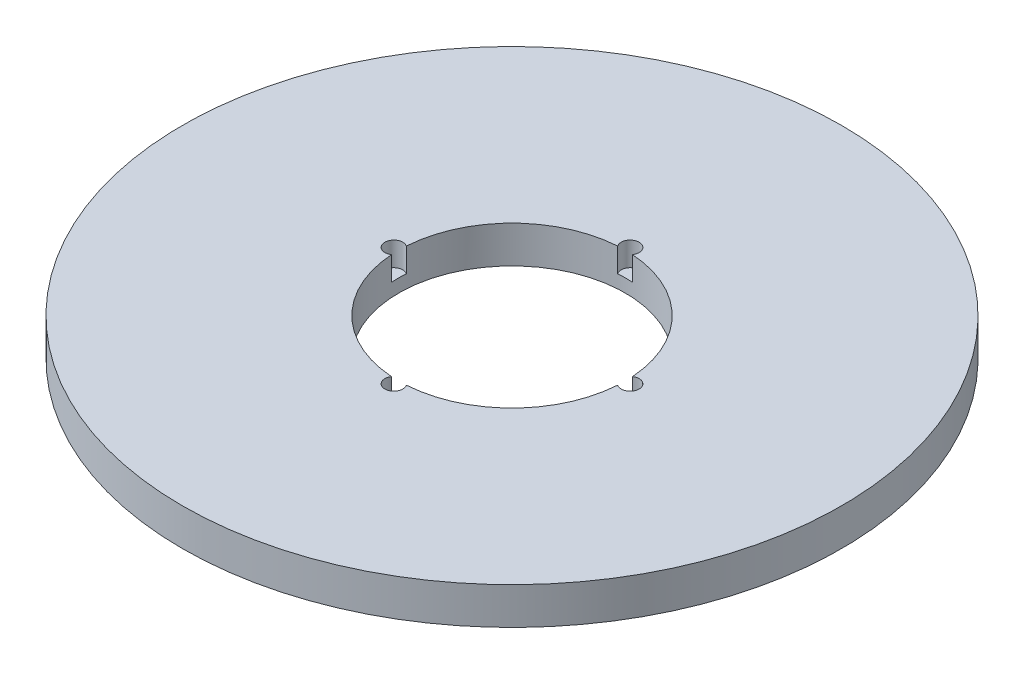
from build123d import *

# Parameters (mm, degrees)
SKETCH1_R           = 80
BOSS_EXTRUDE1_DEPTH = 9
SKETCH2_R           = 27.5
CUT_EXTRUDE1_DEPTH  = 114.494493258
SKETCH3_R           = 2.180872626
CUT_EXTRUDE2_DEPTH  = 5.818115606
CIRPATTERN1_COUNT   = 4


with BuildPart() as part:
    # Sketch1 → Boss-Extrude1 (new body)
    with BuildSketch(Plane(origin=(0, 0, 0), x_dir=(1, 0, 0), z_dir=(0, 1, 0))):
        Circle(SKETCH1_R)
    extrude(amount=BOSS_EXTRUDE1_DEPTH)

    # Sketch2 → Cut-Extrude1 (cut, through all)
    with BuildSketch(Plane(origin=(0, 0, 0), x_dir=(1, 0, 0), z_dir=(0, 1, 0))):
        Circle(SKETCH2_R)
    extrude(amount=CUT_EXTRUDE1_DEPTH, mode=Mode.SUBTRACT)

    # Sketch3 → Cut-Extrude2 (cut)
    with BuildSketch(Plane(origin=(0, 9, 0), x_dir=(1, 0, 0), z_dir=(0, 1, 0))):
        with Locations((-28.687260225, 0)):
            Circle(SKETCH3_R)
    cut_extrude2 = extrude(amount=-CUT_EXTRUDE2_DEPTH, mode=Mode.SUBTRACT)

    # CirPattern1: Cut-Extrude2 ×4 about axis
    cirpattern1_axis = Axis((0, 0, 0), (0, 1, 0))
    for i in range(1, CIRPATTERN1_COUNT):
        add(cut_extrude2.rotate(cirpattern1_axis, i * 360 / CIRPATTERN1_COUNT), mode=Mode.SUBTRACT)


solid = part.part
